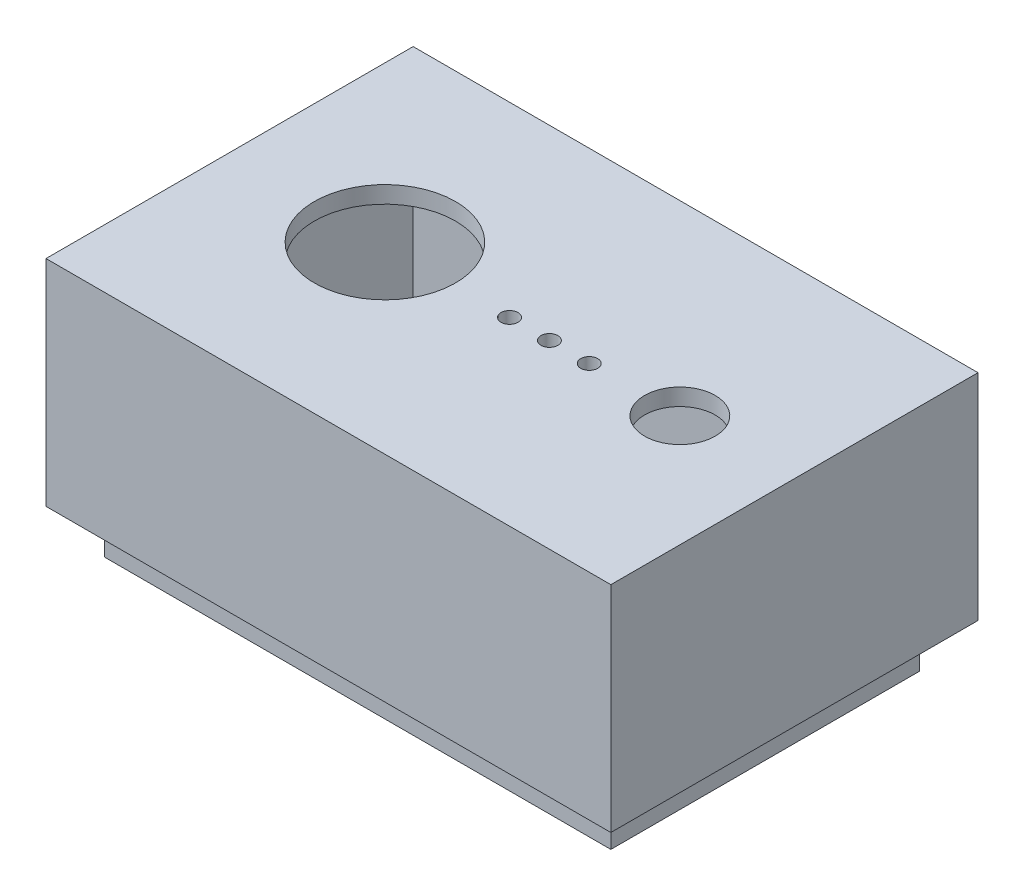
from build123d import *

# Parameters (mm, degrees)
STOCK_PART1_1_START         = 40
STOCK_PART1_1_OUTLINE_W     = 90
STOCK_PART1_1_OUTLINE_H     = 55
STOCK_PART1_1_DEPTH         = 40
STOCK_PART1_1_START_2       = 75
STOCK_PART1_1_2_OUTLINE_W   = 90
STOCK_PART1_1_2_OUTLINE_H   = 55
STOCK_PART1_1_2_OUTLINE_R   = 6.10322586
STOCK_PART1_1_2_OUTLINE_R_2 = 17.5
STOCK_PART1_1_2_DEPTH       = 5
SKETCH1_W                   = 5
SKETCH1_H                   = 8.27683309
SKETCH1_W_2                 = 4.100738493
SKETCH1_H_2                 = 4.176305195
SKETCH1_W_3                 = 4.702811088
SKETCH1_H_3                 = 4.424974218
SKETCH1_W_4                 = 6.384187924
SKETCH1_H_4                 = 4.971555085
BOSS_EXTRUDE2_DEPTH         = 40
SKETCH2_W                   = 90
SKETCH2_H                   = 55
SKETCH2_W_2                 = 87.6
SKETCH2_H_2                 = 52.6
EXTRUDE_THIN1_DEPTH         = 35
SKETCH3_W                   = 89.6
SKETCH3_H                   = 54.6
SKETCH3_W_2                 = 87.6
SKETCH3_H_2                 = 52.6
EXTRUDE_THIN2_DEPTH         = 35
SKETCH4_R                   = 23.5
SKETCH4_R_2                 = 12.5
EXTRUDE_THIN3_DEPTH         = 5
SKETCH5_W                   = 54.6
SKETCH5_H                   = 27.201852287
CUT_EXTRUDE1_DEPTH          = 115
SKETCH6_W                   = 87.6
SKETCH6_H                   = 52.6
SKETCH6_W_2                 = 86.6
SKETCH6_H_2                 = 51.6
EXTRUDE_THIN4_DEPTH         = 43
SKETCH8_W                   = 92.344497842
SKETCH8_H                   = 10.122612515
CUT_EXTRUDE3_DEPTH          = 97.8
SKETCH7_W                   = 89.6
SKETCH7_H                   = 54.6
SKETCH7_W_2                 = 86.6
SKETCH7_H_2                 = 51.6
EXTRUDE_THIN5_DEPTH         = 7.8
SKETCH9_R                   = 6.25
CUT_EXTRUDE4_DEPTH          = 37.8
SKETCH11_W                  = 37.538664257
SKETCH11_H                  = 33.375163033
BOSS_EXTRUDE3_DEPTH         = 5
SKETCH10_R                  = 12.5
CUT_EXTRUDE5_DEPTH          = 5
SKETCH12_W                  = 100
SKETCH12_H                  = 2
CUT_EXTRUDE6_DEPTH          = 135
SKETCH14_R                  = 1.5
CUT_EXTRUDE7_DEPTH          = 135


# Read off the part's stored shape, not the designer's step: Stock-Part1-1
with BuildPart() as part:
    # Stock-Part1-1 outline → Stock-Part1-1 (new body)
    with BuildSketch(Plane(origin=(0, 0, 0), x_dir=(1, 0, 0), z_dir=(0, 1, 0)).offset(STOCK_PART1_1_START)):
        with BuildLine():
            Line((55.93220339, -29.999229584), (55.93220339, 31.000770416))
            ThreePointArc((55.93220339, 31.000770416), (52.517989827, 29.586556854), (53.93220339, 33.000770416))
            Line((53.93220339, 33.000770416), (-42.06779661, 33.000770416))
            ThreePointArc((-42.06779661, 33.000770416), (-40.653583048, 29.586556854), (-44.06779661, 31.000770416))
            Line((-44.06779661, 31.000770416), (-44.06779661, -29.999229584))
            ThreePointArc((-44.06779661, -29.999229584), (-40.653583048, -28.585016022), (-42.06779661, -31.999229584))
            Line((-42.06779661, -31.999229584), (53.93220339, -31.999229584))
            ThreePointArc((53.93220339, -31.999229584), (52.517989827, -28.585016021), (55.93220339, -29.999229584))
        make_face()
        with Locations((5.93220339, 0.500770416)):
            Rectangle(STOCK_PART1_1_OUTLINE_W, STOCK_PART1_1_OUTLINE_H, mode=Mode.SUBTRACT)
    extrude(amount=STOCK_PART1_1_DEPTH)

    # Stock-Part1-1 2 outline → Stock-Part1-1 2 (add)
    with BuildSketch(Plane(origin=(0, 0, 0), x_dir=(1, 0, 0), z_dir=(0, 1, 0)).offset(STOCK_PART1_1_START_2)):
        with Locations((5.93220339, 0.500770416)):
            Rectangle(STOCK_PART1_1_2_OUTLINE_W, STOCK_PART1_1_2_OUTLINE_H)
        with Locations((36.155377847, 0)):
            Circle(STOCK_PART1_1_2_OUTLINE_R, mode=Mode.SUBTRACT)
        with Locations((-11.56779661, 0.500770416)):
            Circle(STOCK_PART1_1_2_OUTLINE_R_2, mode=Mode.SUBTRACT)
    extrude(amount=STOCK_PART1_1_2_DEPTH)

    # Sketch1 → Boss-Extrude2 (add)
    with BuildSketch(Plane.XZ.offset(-40)):
        with Locations((-41.56779661, -28.862353871)):
            Rectangle(SKETCH1_W, SKETCH1_H)
        with Locations((53.881834144, -30.912617819)):
            Rectangle(SKETCH1_W_2, SKETCH1_H_2)
        with Locations((53.580797846, 29.786742475)):
            Rectangle(SKETCH1_W_3, SKETCH1_H_3)
        with Locations((-40.875702648, 29.513452042)):
            Rectangle(SKETCH1_W_4, SKETCH1_H_4)
    extrude(amount=-BOSS_EXTRUDE2_DEPTH)

    # Sketch2 → Extrude-Thin1 (add)
    with BuildSketch(Plane.XZ.offset(-75)):
        with Locations((5.93220339, -0.500770416)):
            Rectangle(SKETCH2_W, SKETCH2_H)
        with Locations((5.93220339, -0.500770416)):
            Rectangle(SKETCH2_W_2, SKETCH2_H_2, mode=Mode.SUBTRACT)
    extrude(amount=EXTRUDE_THIN1_DEPTH)

    # Sketch3 → Extrude-Thin2 (add)
    with BuildSketch(Plane.XZ.offset(-40)):
        with Locations((5.93220339, -0.500770416)):
            Rectangle(SKETCH3_W, SKETCH3_H)
        with Locations((5.93220339, -0.500770416)):
            Rectangle(SKETCH3_W_2, SKETCH3_H_2, mode=Mode.SUBTRACT)
    extrude(amount=EXTRUDE_THIN2_DEPTH)

    # Sketch4 → Extrude-Thin3 (add)
    with BuildSketch(Plane(origin=(0, 80, 0), x_dir=(1, 0, 0), z_dir=(0, 1, 0))):
        with Locations((-11.56779661, 0.500770416)):
            Circle(SKETCH4_R)
        with Locations((-11.56779661, 0.500770416)):
            Circle(SKETCH4_R_2, mode=Mode.SUBTRACT)
    extrude(amount=-EXTRUDE_THIN3_DEPTH)

    # Sketch5 → Cut-Extrude1 (cut)
    with BuildSketch(Plane.ZY.offset(38.86779661)):
        with Locations((-0.500770416, 18.600926144)):
            Rectangle(SKETCH5_W, SKETCH5_H)
    extrude(amount=-CUT_EXTRUDE1_DEPTH, mode=Mode.SUBTRACT)

    # Sketch6 → Extrude-Thin4 (add)
    with BuildSketch(Plane.XZ.offset(-75)):
        with Locations((5.93220339, -0.500770416)):
            Rectangle(SKETCH6_W, SKETCH6_H)
        with Locations((5.93220339, -0.500770416)):
            Rectangle(SKETCH6_W_2, SKETCH6_H_2, mode=Mode.SUBTRACT)
    extrude(amount=EXTRUDE_THIN4_DEPTH)

    # Sketch8 → Cut-Extrude3 (cut)
    with BuildSketch(Plane.XY.offset(26.799229584)):
        with Locations((7.304452311, 34.938693742)):
            Rectangle(SKETCH8_W, SKETCH8_H)
    extrude(amount=-CUT_EXTRUDE3_DEPTH, mode=Mode.SUBTRACT)

    # Sketch7 → Extrude-Thin5 (add)
    with BuildSketch(Plane.XZ.offset(-32.201852287)):
        with Locations((5.93220339, -0.500770416)):
            Rectangle(SKETCH7_W, SKETCH7_H)
        with Locations((5.93220339, -0.500770416)):
            Rectangle(SKETCH7_W_2, SKETCH7_H_2, mode=Mode.SUBTRACT)
    extrude(amount=-EXTRUDE_THIN5_DEPTH)

    # Sketch9 → Cut-Extrude4 (cut)
    with BuildSketch(Plane.XZ.offset(-75)):
        with Locations(Location((36.155377847, 0, 0), (0, 0, 270))):
            Circle(SKETCH9_R)
    extrude(amount=-CUT_EXTRUDE4_DEPTH, mode=Mode.SUBTRACT)

    # Sketch11 → Boss-Extrude3 (add)
    with BuildSketch(Plane(origin=(0, 80, 0), x_dir=(1, 0, 0), z_dir=(0, 1, 0))):
        with Locations((-12.97143523, -0.741564626)):
            Rectangle(SKETCH11_W, SKETCH11_H)
    extrude(amount=-BOSS_EXTRUDE3_DEPTH)

    # Sketch10 → Cut-Extrude5 (cut)
    with BuildSketch(Plane.XZ.offset(-75)):
        with Locations(Location((-16.56779661, -0.500770416, 0), (0, 0, 270))):
            Circle(SKETCH10_R)
    extrude(amount=-CUT_EXTRUDE5_DEPTH, mode=Mode.SUBTRACT)

    # Sketch12 → Cut-Extrude6 (cut)
    with BuildSketch(Plane.XY.offset(31.999229584)):
        with Locations((5.93220339, 79)):
            Rectangle(SKETCH12_W, SKETCH12_H)
    extrude(amount=-CUT_EXTRUDE6_DEPTH, mode=Mode.SUBTRACT)

    # Sketch14 → Cut-Extrude7 (cut)
    with BuildSketch(Plane(origin=(0, 78, 0), x_dir=(1, 0, 0), z_dir=(0, 1, 0))):
        with Locations(Location((13.055377847, 0, 0), (0, 0, 270))):
            Circle(SKETCH14_R)
        with Locations(Location((20.105377847, 0, 0), (0, 0, 270))):
            Circle(SKETCH14_R)
        with Locations(Location((5.992200992, 0, 0), (0, 0, 270))):
            Circle(SKETCH14_R)
    extrude(amount=-CUT_EXTRUDE7_DEPTH, mode=Mode.SUBTRACT)


solid = part.part
